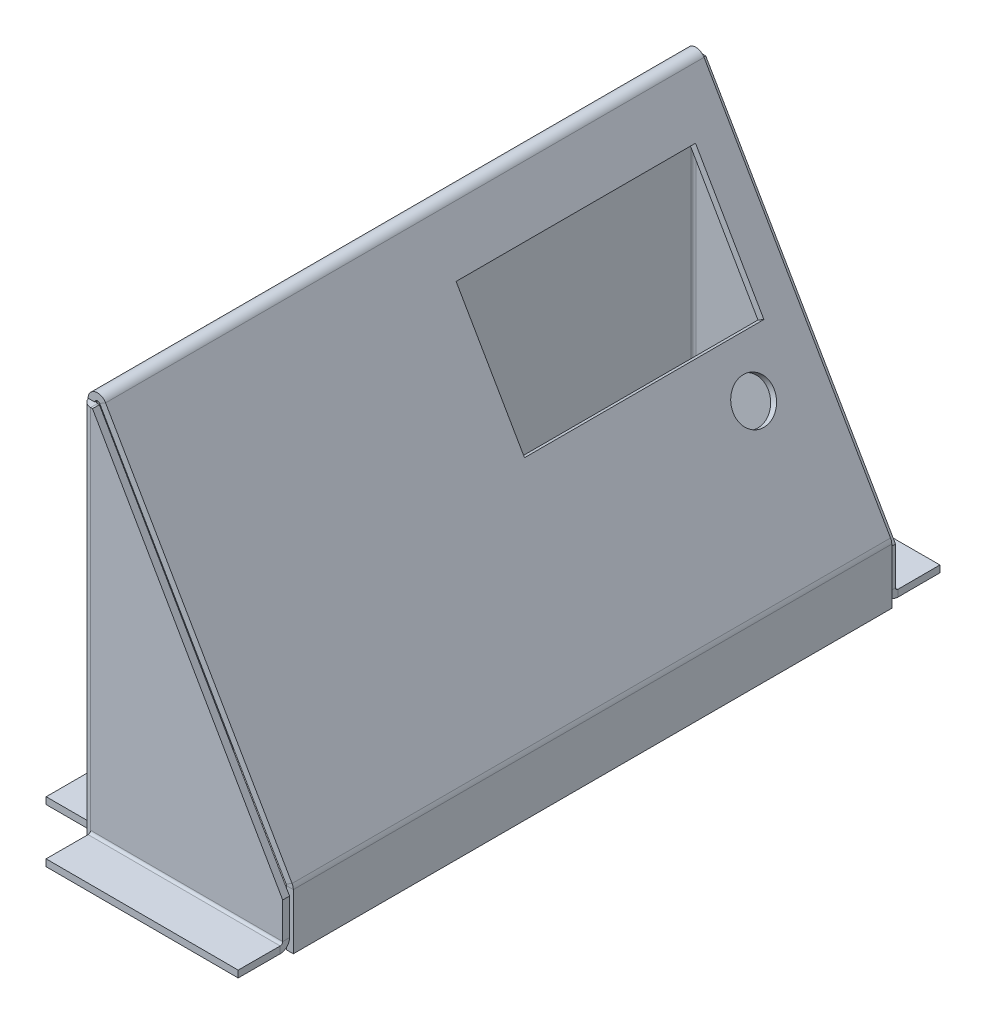
from build123d import *

# Parameters (mm, degrees)
CROQUIS3_W                         = 120
CROQUIS3_H                         = 175
BRIDA_BASE1_DEPTH                  = 2
BRIDA_START                        = -87.5
BRIDA_DE_ARISTA1_DEPTH             = 175
BRIDA_DE_ARISTA1_2_DEPTH           = 175
BRIDA_DE_ARISTA2_DEPTH             = 175
BRIDA_DE_ARISTA2_2_DEPTH           = 175
BRIDA_DE_ARISTA3_STRIP_CUT_DEPTH   = 109.78686976
BRIDA_DE_ARISTA3_STRIP_CUT_2_DEPTH = 109.78686976
BRIDA_DE_ARISTA3_DEPTH             = 109.78686976
BRIDA_DE_ARISTA3_BEND_DEPTH        = 109.78686976
CORTAR_EXTRUIR5_DEPTH              = 2
CORTAR_EXTRUIR6_DEPTH              = 2
BRIDA_DE_ARISTA4_STRIP_W           = 9.4732
BRIDA_DE_ARISTA4_STRIP_H           = 2
BRIDA_DE_ARISTA4_STRIP_CUT_DEPTH   = 56.268172105
BRIDA_DE_ARISTA4_STRIP_2_W         = 9.4732
BRIDA_DE_ARISTA4_STRIP_2_H         = 2
BRIDA_DE_ARISTA4_STRIP_CUT_2_DEPTH = 173.529368978
BRIDA_DE_ARISTA4_STRIP_3_W         = 9.4732
BRIDA_DE_ARISTA4_STRIP_3_H         = 2
BRIDA_DE_ARISTA4_STRIP_CUT_3_DEPTH = 56.268172105
BRIDA_DE_ARISTA4_DEPTH             = 56.268172105
BRIDA_DE_ARISTA4_BEND_DEPTH        = 173.529368978
BRIDA_DE_ARISTA4_BEND_2_DEPTH      = 56.268172105
CROQUIS37_R                        = 6
CROQUIS37_W                        = 70
CROQUIS37_H                        = 40
CORTAR_EXTRUIR7_DEPTH              = 2


# Read off the part's stored shape, not the designer's step: Brida de arista1, Brida de arista2
# Sheet-metal steps are written as plain solids
with BuildPart() as part:
    # Croquis3 → Brida base1 (new body)
    with BuildSketch(Plane(origin=(45, 25.980762114, 0), x_dir=(0.5000000000000044, -0.8660254037844362, 0), z_dir=(-0.8660254037844362, -0.5000000000000044, 0))):
        with Locations((-30, 0)):
            Rectangle(CROQUIS3_W, CROQUIS3_H)
    extrude(amount=-BRIDA_BASE1_DEPTH)

    # Brida de arista1 outline → Brida de arista1 (cut)
    with BuildSketch(Plane.XY.offset(BRIDA_START)):
        with BuildLine():
            Line((0, 103.923048454), (2.056713114, 100.360716845))
            ThreePointArc((2.056713114, 100.360716845), (3.797397716, 100.232553298), (5.10656512, 99.078218214))
            Line((5.10656512, 99.078218214), (1.732050808, 104.923048454))
            Line((1.732050808, 104.923048454), (0, 103.923048454))
        make_face()
    extrude(amount=BRIDA_DE_ARISTA1_DEPTH, mode=Mode.SUBTRACT)

    # Brida de arista1 2 outline → Brida de arista1 2 (add)
    with BuildSketch(Plane.XY.offset(BRIDA_START)):
        with BuildLine():
            ThreePointArc((2.056713114, 100.360716845), (0.574476274, 99.387476127), (0, 97.709918214))
            Line((0, 97.709918214), (0, -12.076951546))
            Line((0, -12.076951546), (2, -12.076951546))
            Line((2, -12.076951546), (2, 97.709918214))
            ThreePointArc((2, 97.709918214), (2.545953891, 98.421419178), (3.374514312, 98.078218214))
            Line((3.374514312, 98.078218214), (2.056713114, 100.360716845))
        make_face()
    extrude(amount=BRIDA_DE_ARISTA1_2_DEPTH)

    # Brida de arista2 outline → Brida de arista2 (cut)
    with BuildSketch(Plane.XY.offset(BRIDA_START)):
        with BuildLine():
            ThreePointArc((59.63336512, 4.63503024), (59.906752616, 3.975014439), (60, 3.26673024))
            Line((60, 3.26673024), (60, 0))
            Line((60, 0), (61.732050808, 1))
            Line((61.732050808, 1), (59.63336512, 4.63503024))
        make_face()
    extrude(amount=BRIDA_DE_ARISTA2_DEPTH, mode=Mode.SUBTRACT)

    # Brida de arista2 2 outline → Brida de arista2 2 (add)
    with BuildSketch(Plane.XY.offset(BRIDA_START)):
        with BuildLine():
            Line((60, -13), (60, 0))
            Line((60, 0), (57.901314312, 3.63503024))
            ThreePointArc((57.901314312, 3.63503024), (57.974900964, 3.457376349), (58, 3.26673024))
            Line((58, 3.26673024), (58, -13))
            Line((58, -13), (60, -13))
        make_face()
    extrude(amount=BRIDA_DE_ARISTA2_2_DEPTH)

    # Brida de arista3 strip (across the edge) → Brida de arista3 strip cut (cut)
    with BuildSketch(Plane(origin=(2, -12.076951546, -87.5), x_dir=(0.0017453283659016917, 0, 0.9999984769132877), z_dir=(0, 1, 0))):
        Polygon((-8.741361837, -1.984746476), (0.731823734, -2.001280321), (0.735314391, -0.001283367), (-8.73787118, 0.015250478), align=None)
    extrude(amount=BRIDA_DE_ARISTA3_STRIP_CUT_DEPTH, mode=Mode.SUBTRACT)

    # Brida de arista3 strip 2 (across the edge) → Brida de arista3 strip cut 2 (cut)
    with BuildSketch(Plane(origin=(2, 97.709918214, 87.5), x_dir=(0.0017453283659016917, 0, -0.9999984769132877), z_dir=(0, -1, 0))):
        Polygon((-8.741361837, -1.984746476), (0.731823734, -2.001280321), (0.735314391, -0.001283367), (-8.73787118, 0.015250478), align=None)
    extrude(amount=BRIDA_DE_ARISTA3_STRIP_CUT_2_DEPTH, mode=Mode.SUBTRACT)

    # Brida de arista3 section (across the edge) → Brida de arista3 (add)
    with BuildSketch(Plane(origin=(2, -12.076951546, -87.5), x_dir=(0.0017453283659016917, 0, 0.9999984769132877), z_dir=(0, 1, 0))):
        with BuildLine():
            Line((-2, 0.735315511), (-2, 57.003487616))
            Line((-2, 57.003487616), (0, 57.003487616))
            Line((0, 57.003487616), (0, 0.735315511))
            ThreePointArc((0, 0.735315511), (0.215290812, 0.214915386), (0.735314391, -0.001283367))
            Line((0.735314391, -0.001283367), (0.731823734, -2.001280321))
            ThreePointArc((0.731823734, -2.001280321), (-1.200156346, -1.198063504), (-2, 0.735315511))
        make_face()
    extrude(amount=BRIDA_DE_ARISTA3_DEPTH)

    # Brida de arista3 section 2 (across the edge) → Brida de arista3 bend (add)
    with BuildSketch(Plane(origin=(2, 97.709918214, 87.5), x_dir=(0.0017453283659016917, 0, -0.9999984769132877), z_dir=(0, -1, 0))):
        with BuildLine():
            Line((-2, 0.735315511), (-2, 57.003487616))
            Line((-2, 57.003487616), (0, 57.003487616))
            Line((0, 57.003487616), (0, 0.735315511))
            ThreePointArc((0, 0.735315511), (0.215290812, 0.214915386), (0.735314391, -0.001283367))
            Line((0.735314391, -0.001283367), (0.731823734, -2.001280321))
            ThreePointArc((0.731823734, -2.001280321), (-1.200156346, -1.198063504), (-2, 0.735315511))
        make_face()
    extrude(amount=BRIDA_DE_ARISTA3_BEND_DEPTH)

    # Croquis23 → Cortar-Extruir5 (cut)
    with BuildSketch(Plane(origin=(-0.156200564, 0, 89.496239762), x_dir=(0.9999984769132877, 0, 0.0017453283659016985), z_dir=(-0.0017453283659016987, 0, 0.9999984769132878))):
        Polygon((3.221792941, 98.078218214), (57.748509892, 3.63503024), (59.156200802, 1.196834349), (59.156200802, 97.709918214), align=None)
    extrude(amount=-CORTAR_EXTRUIR5_DEPTH, mode=Mode.SUBTRACT)

    # Croquis24 → Cortar-Extruir6 (cut)
    with BuildSketch(Plane(origin=(-0.156200564, 0, -89.496239762), x_dir=(-0.9999984769132877, 0, 0.001745328365901773), z_dir=(-0.0017453283659017733, 0, -0.9999984769132878))):
        Polygon((-3.527225405, 98.078218214), (-58.053942356, 3.63503024), (-59.156200802, 1.725859701), (-59.156200802, 97.709918214), align=None)
    extrude(amount=-CORTAR_EXTRUIR6_DEPTH, mode=Mode.SUBTRACT)

    # Brida de arista4 strip (across the edge) → Brida de arista4 strip cut (cut)
    with BuildSketch(Plane(origin=(58.999910138, -12.076951546, -89.599486758), x_dir=(0, 1, 0), z_dir=(-0.9999984769132877, -4.100332633432973e-15, 0.00174532836590182))):
        with Locations((-2, -1)):
            Rectangle(BRIDA_DE_ARISTA4_STRIP_W, BRIDA_DE_ARISTA4_STRIP_H)
    extrude(amount=BRIDA_DE_ARISTA4_STRIP_CUT_DEPTH, mode=Mode.SUBTRACT)

    # Brida de arista4 strip 2 (across the edge) → Brida de arista4 strip cut 2 (cut)
    with BuildSketch(Plane(origin=(0, -12.076951546, -86.764684489), x_dir=(0, 1, 0), z_dir=(0, 0, 1))):
        with Locations((-2, -1)):
            Rectangle(BRIDA_DE_ARISTA4_STRIP_2_W, BRIDA_DE_ARISTA4_STRIP_2_H)
    extrude(amount=BRIDA_DE_ARISTA4_STRIP_CUT_2_DEPTH, mode=Mode.SUBTRACT)

    # Brida de arista4 strip 3 (across the edge) → Brida de arista4 strip cut 3 (cut)
    with BuildSketch(Plane(origin=(2.731823734, -12.076951546, 89.501280321), x_dir=(0, 1, 0), z_dir=(0.9999984769132877, 2.0039219637078435e-15, 0.0017453283659018195))):
        with Locations((-2, -1)):
            Rectangle(BRIDA_DE_ARISTA4_STRIP_3_W, BRIDA_DE_ARISTA4_STRIP_3_H)
    extrude(amount=BRIDA_DE_ARISTA4_STRIP_CUT_3_DEPTH, mode=Mode.SUBTRACT)

    # Brida de arista4 section (across the edge) → Brida de arista4 (add)
    with BuildSketch(Plane(origin=(58.999910138, -12.076951546, -89.599486758), x_dir=(0, 1, 0), z_dir=(-0.9999984769132877, -4.100332633432973e-15, 0.00174532836590182))):
        with BuildLine():
            Line((0, 0.7366), (0, 13))
            Line((0, 13), (2, 13))
            Line((2, 13), (2, 0.7366))
            ThreePointArc((2, 0.7366), (2.215745145, 0.215745145), (2.7366, 0))
            Line((2.7366, 0), (2.7366, -2))
            ThreePointArc((2.7366, -2), (0.801531583, -1.198468417), (0, 0.7366))
        make_face()
    extrude(amount=BRIDA_DE_ARISTA4_DEPTH)

    # Brida de arista4 section 2 (across the edge) → Brida de arista4 bend (add)
    with BuildSketch(Plane(origin=(0, -12.076951546, -86.764684489), x_dir=(0, 1, 0), z_dir=(0, 0, 1))):
        with BuildLine():
            Line((0, 0.7366), (0, 13))
            Line((0, 13), (2, 13))
            Line((2, 13), (2, 0.7366))
            ThreePointArc((2, 0.7366), (2.215745145, 0.215745145), (2.7366, 0))
            Line((2.7366, 0), (2.7366, -2))
            ThreePointArc((2.7366, -2), (0.801531583, -1.198468417), (0, 0.7366))
        make_face()
    extrude(amount=BRIDA_DE_ARISTA4_BEND_DEPTH)

    # Brida de arista4 section 3 (across the edge) → Brida de arista4 bend 2 (add)
    with BuildSketch(Plane(origin=(2.731823734, -12.076951546, 89.501280321), x_dir=(0, 1, 0), z_dir=(0.9999984769132877, 2.0039219637078435e-15, 0.0017453283659018195))):
        with BuildLine():
            Line((0, 0.7366), (0, 13))
            Line((0, 13), (2, 13))
            Line((2, 13), (2, 0.7366))
            ThreePointArc((2, 0.7366), (2.215745145, 0.215745145), (2.7366, 0))
            Line((2.7366, 0), (2.7366, -2))
            ThreePointArc((2.7366, -2), (0.801531583, -1.198468417), (0, 0.7366))
        make_face()
    extrude(amount=BRIDA_DE_ARISTA4_BEND_2_DEPTH)

    # Croquis37 → Cortar-Extruir7 (cut)
    with BuildSketch(Plane(origin=(46.732050808, 26.980762114, 0), x_dir=(0, 0, -1), z_dir=(0.866025403784436, 0.5000000000000047, 0))):
        with Locations(Location((67.5, 14.250971375, 0), (0, 0, 90))):
            Circle(CROQUIS37_R)
        with Locations((42.5, 48.250971375)):
            Rectangle(CROQUIS37_W, CROQUIS37_H)
    extrude(amount=-CORTAR_EXTRUIR7_DEPTH, mode=Mode.SUBTRACT)


solid = part.part
